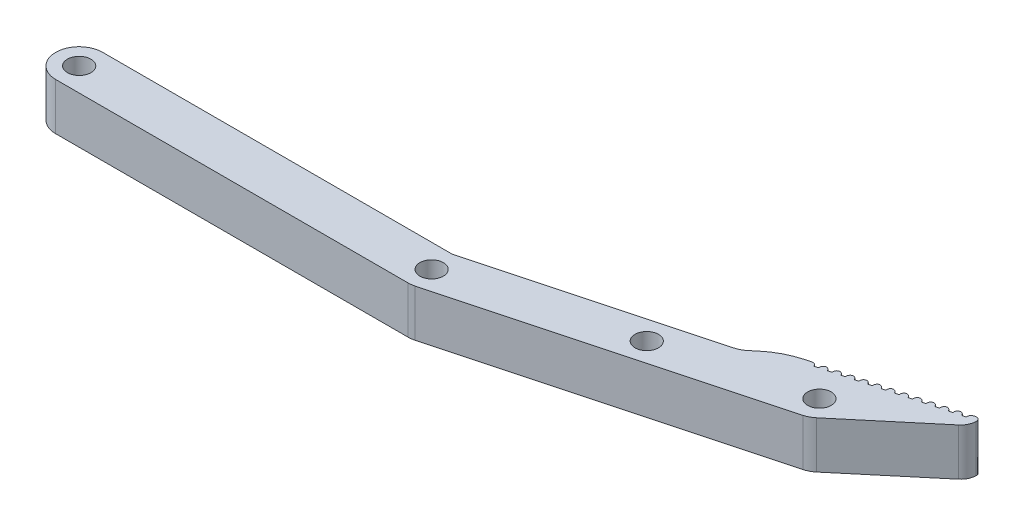
from build123d import *

# Parameters (mm, degrees)
SKETCH1_R           = 1.5
BOSS_EXTRUDE1_DEPTH = 6
SKETCH2_W           = 0.5
SKETCH2_H           = 6
CUT_EXTRUDE1_DEPTH  = 0.5
FILLET1_R           = 0.5


with BuildPart() as part:
    # Sketch1 → Boss-Extrude1 (new body)
    with BuildSketch(Plane(origin=(0, 0, 0), x_dir=(1, 0, 0), z_dir=(0, 1, 0))):
        with BuildLine():
            ThreePointArc((95.828517615, 16.432423404), (96.485539703, 17.415726447), (96.511338172, 18.598053533))
            Line((96.511338172, 18.598053533), (78.7360041, 13.835167123))
            ThreePointArc((78.7360041, 13.835167123), (76.706708419, 13.046017192), (74.896318454, 11.836353292))
            Line((74.896318454, 11.836353292), (74.145485774, 11.206329867))
            ThreePointArc((74.145485774, 11.206329867), (73.602368785, 10.843430696), (72.99358008, 10.606685717))
            Line((72.99358008, 10.606685717), (44.605042506, 3))
            Line((44.605042506, 3), (0, 3))
            ThreePointArc((0, 3), (-3, 0), (0, -3))
            Line((0, -3), (44.999999999, -3))
            ThreePointArc((44.999999999, -3), (45.391578576, -2.974334584), (45.776457135, -2.897777479))
            Line((45.776457135, -2.897777479), (84.823166373, 7.564756729))
            ThreePointArc((84.823166373, 7.564756729), (85.431955077, 7.801501708), (85.975072067, 8.164400878))
            Line((85.975072067, 8.164400878), (95.828517615, 16.432423404))
        make_face()
        with Locations(Location((66.660044365, 5.803791396, 0), (0, 0, 270))):
            Circle(SKETCH1_R, mode=Mode.SUBTRACT)
        with Locations(Location((84.046709238, 10.462534208, 0), (0, 0, 270))):
            Circle(SKETCH1_R, mode=Mode.SUBTRACT)
        with Locations(Location((44.999999999, 0, 0), (0, 0, 270))):
            Circle(SKETCH1_R, mode=Mode.SUBTRACT)
        with Locations(Location((0, 0, 0), (0, 0, 270))):
            Circle(SKETCH1_R, mode=Mode.SUBTRACT)
    extrude(amount=BOSS_EXTRUDE1_DEPTH)

    # Sketch2 → Cut-Extrude1 (cut)
    with BuildSketch(Plane(origin=(1.815520398, 0, 6.775614366), x_dir=(-0.965925826289068, 0, 0.25881904510252224), z_dir=(-0.2588190451025222, 0, -0.9659258262890679))):
        with Locations((-81.167277896, 3)):
            Rectangle(SKETCH2_W, SKETCH2_H)
        with Locations((-82.567277896, 3)):
            Rectangle(SKETCH2_W, SKETCH2_H)
        with Locations((-83.967277896, 3)):
            Rectangle(SKETCH2_W, SKETCH2_H)
        with Locations((-85.367277896, 3)):
            Rectangle(SKETCH2_W, SKETCH2_H)
        with Locations((-86.767277896, 3)):
            Rectangle(SKETCH2_W, SKETCH2_H)
        with Locations((-88.167277896, 3)):
            Rectangle(SKETCH2_W, SKETCH2_H)
        with Locations((-89.567277896, 3)):
            Rectangle(SKETCH2_W, SKETCH2_H)
        with Locations((-90.967277896, 3)):
            Rectangle(SKETCH2_W, SKETCH2_H)
        with Locations((-92.367277896, 3)):
            Rectangle(SKETCH2_W, SKETCH2_H)
        with Locations((-93.767277896, 3)):
            Rectangle(SKETCH2_W, SKETCH2_H)
        with Locations((-95.167277896, 3)):
            Rectangle(SKETCH2_W, SKETCH2_H)
        with Locations((-96.567277896, 3)):
            Rectangle(SKETCH2_W, SKETCH2_H)
    extrude(amount=-CUT_EXTRUDE1_DEPTH, mode=Mode.SUBTRACT)

    # Fillet1
    # the kernel refuses this fillet: 0.5 mm, written as the material it takes off along each edge
    with BuildSketch(Plane(origin=(79.97560891, -1.25, -14.167318231), x_dir=(-0.9659258262890682, 0, 0.25881904510252096), z_dir=(0, 1, 0)), Plane(origin=(81.81086798, -1.25, -14.659074417), x_dir=(0.25881904510251386, 0, 0.9659258262890702), z_dir=(0, 1, 0)), Plane(origin=(83.163164137, -1.25, -15.02142108), x_dir=(0.2588190451025112, 0, 0.9659258262890709), z_dir=(0, 1, 0)), Plane(origin=(84.515460294, -1.25, -15.383767743), x_dir=(0.25881904510251386, 0, 0.9659258262890702), z_dir=(0, 1, 0)), Plane(origin=(85.86775645, -1.25, -15.746114406), x_dir=(0.25881904510251386, 0, 0.9659258262890702), z_dir=(0, 1, 0)), Plane(origin=(87.220052607, -1.25, -16.108461069), x_dir=(0.25881904510251214, 0, 0.9659258262890708), z_dir=(0, 1, 0)), Plane(origin=(88.572348764, -1.25, -16.470807733), x_dir=(0.25881904510251386, 0, 0.9659258262890702), z_dir=(0, 1, 0)), Plane(origin=(89.924644921, -1.25, -16.833154396), x_dir=(0.25881904510251386, 0, 0.9659258262890702), z_dir=(0, 1, 0)), Plane(origin=(91.276941078, -1.25, -17.195501059), x_dir=(0.25881904510251386, 0, 0.9659258262890702), z_dir=(0, 1, 0)), Plane(origin=(92.629237234, -1.25, -17.557847722), x_dir=(0.25881904510251563, 0, 0.9659258262890698), z_dir=(0, 1, 0)), Plane(origin=(93.981533391, -1.25, -17.920194385), x_dir=(0.25881904510251563, 0, 0.9659258262890698), z_dir=(0, 1, 0))) as fillet1_piece_1:
        with BuildLine():
            CenterArc((FILLET1_R, FILLET1_R), FILLET1_R, 180, 90)
            Line((0, FILLET1_R), (0, 0))
            Line((0, 0), (FILLET1_R, 0))
        make_face()
    extrude(amount=8.5, mode=Mode.SUBTRACT)
    with BuildSketch(Plane(origin=(95.333829548, -1.25, -18.282541048), x_dir=(0.9659258262890649, 0, -0.2588190451025338), z_dir=(0, 1, 0)), Plane(origin=(80.458571823, 7.25, -14.296727754), x_dir=(0.25881904510251386, 0, 0.9659258262890702), z_dir=(0, -1, 0)), Plane(origin=(81.327905067, 7.25, -14.529664894), x_dir=(-0.9659258262890683, 0, 0.25881904510252046), z_dir=(0, -1, 0)), Plane(origin=(82.680201224, 7.25, -14.892011557), x_dir=(-0.9659258262890675, 0, 0.2588190451025238), z_dir=(0, -1, 0)), Plane(origin=(84.03249738, 7.25, -15.254358221), x_dir=(-0.9659258262890682, 0, 0.25881904510252096), z_dir=(0, -1, 0)), Plane(origin=(85.384793537, 7.25, -15.616704884), x_dir=(-0.9659258262890675, 0, 0.2588190451025238), z_dir=(0, -1, 0)), Plane(origin=(86.737089694, 7.25, -15.979051547), x_dir=(-0.9659258262890683, 0, 0.25881904510252046), z_dir=(0, -1, 0)), Plane(origin=(88.089385851, 7.25, -16.34139821), x_dir=(-0.9659258262890683, 0, 0.25881904510252046), z_dir=(0, -1, 0)), Plane(origin=(89.441682008, 7.25, -16.703744873), x_dir=(-0.9659258262890704, 0, 0.2588190451025134), z_dir=(0, -1, 0)), Plane(origin=(90.793978164, 7.25, -17.066091536), x_dir=(-0.9659258262890683, 0, 0.25881904510252046), z_dir=(0, -1, 0)), Plane(origin=(92.146274321, 7.25, -17.428438199), x_dir=(-0.9659258262890701, 0, 0.25881904510251436), z_dir=(0, -1, 0)), Plane(origin=(93.498570478, 7.25, -17.790784863), x_dir=(-0.9659258262890682, 0, 0.25881904510252096), z_dir=(0, -1, 0)), Plane(origin=(94.850866635, 7.25, -18.153131526), x_dir=(-0.9659258262890702, 0, 0.25881904510251386), z_dir=(0, -1, 0))) as fillet1_piece_2:
        with BuildLine():
            CenterArc((FILLET1_R, -FILLET1_R), FILLET1_R, 90, 90)
            Line((0, -FILLET1_R), (0, 0))
            Line((0, 0), (FILLET1_R, 0))
        make_face()
    extrude(amount=8.5, mode=Mode.SUBTRACT)
    with BuildSketch(Plane(origin=(96.511338172, -1.657996846, -18.598053533), x_dir=(0.10403330319637054, 0, 0.9945738141666772), z_dir=(0, 1, 0))) as fillet1_piece_3:
        with BuildLine():
            CenterArc((0.584735643, -0.493805167), FILLET1_R, 80.97147389, 108.05705222)
            Line((0.090930477, -0.572268262), (0, 0))
            ThreePointArc((0, 0), (0.331599369, 0.026180497), (0.663198739, 0))
        make_face()
    extrude(amount=9.315993693, mode=Mode.SUBTRACT)


solid = part.part
